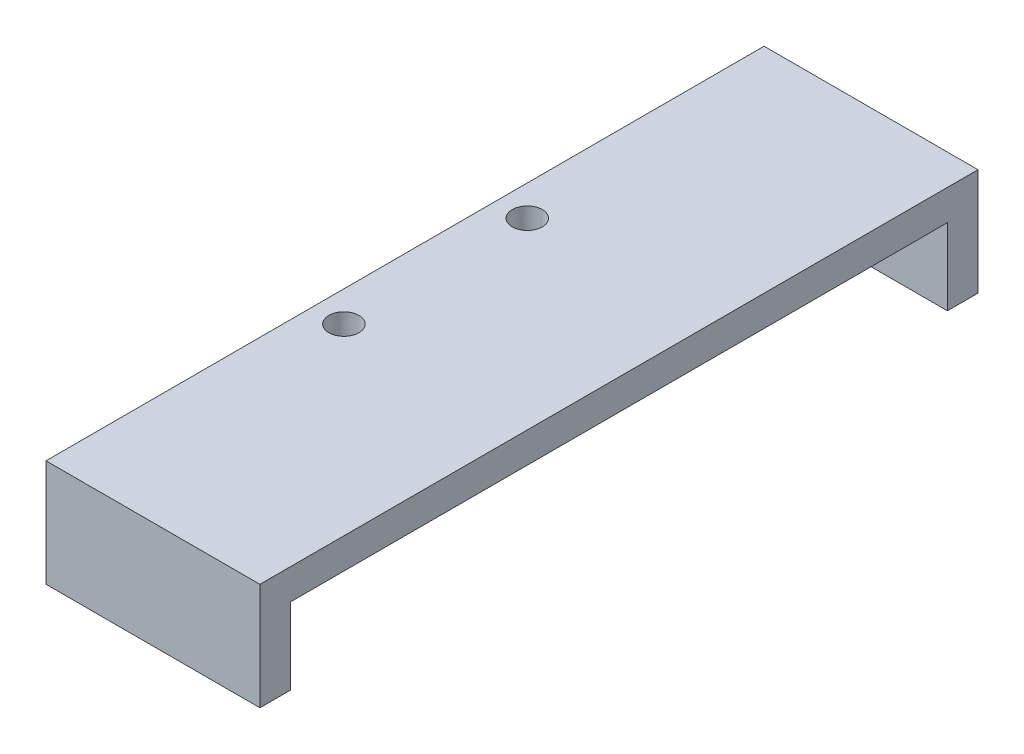
from build123d import *

# Parameters (mm, degrees)
EXTRUDE_THIN1_DEPTH = 17.78
CUT_EXTRUDE1_REACH  = 37.859
SKETCH2_R           = 1.25


with BuildPart() as part:
    # Sketch1 → Extrude-Thin1 (new body)
    with BuildSketch(Plane(origin=(0, 0, 0), x_dir=(0, 0, -1), z_dir=(1, 0, 0))):
        Polygon((-27.305, -6.35), (-27.305, 0), (27.305, 0), (27.305, -6.35), (29.845, -6.35), (29.845, 2.54), (-29.845, 2.54), (-29.845, -6.35), align=None)
    extrude(amount=EXTRUDE_THIN1_DEPTH)

    # Sketch2 → Cut-Extrude1 (cut, up to next)
    with BuildSketch(Plane(origin=(0, 2.54, 0), x_dir=(1, 0, 0), z_dir=(0, 1, 0)), mode=Mode.PRIVATE) as cut_extrude1_sk1:
        with Locations((2.54, 7.62)):
            Circle(SKETCH2_R)
    cut_extrude1_tool1 = extrude(cut_extrude1_sk1.sketch, amount=-CUT_EXTRUDE1_REACH, mode=Mode.PRIVATE) & part.part
    # Sketch2 → Cut-Extrude1 (cut, up to next)
    with BuildSketch(Plane(origin=(0, 2.54, 0), x_dir=(1, 0, 0), z_dir=(0, 1, 0)), mode=Mode.PRIVATE) as cut_extrude1_sk2:
        with Locations((2.54, -7.62)):
            Circle(SKETCH2_R)
    cut_extrude1_tool2 = extrude(cut_extrude1_sk2.sketch, amount=-CUT_EXTRUDE1_REACH, mode=Mode.PRIVATE) & part.part
    add(cut_extrude1_tool1.solids().sort_by_distance((2.54, 2.54, -7.62))[0], mode=Mode.SUBTRACT)
    add(cut_extrude1_tool2.solids().sort_by_distance((2.54, 2.54, 7.62))[0], mode=Mode.SUBTRACT)


solid = part.part
